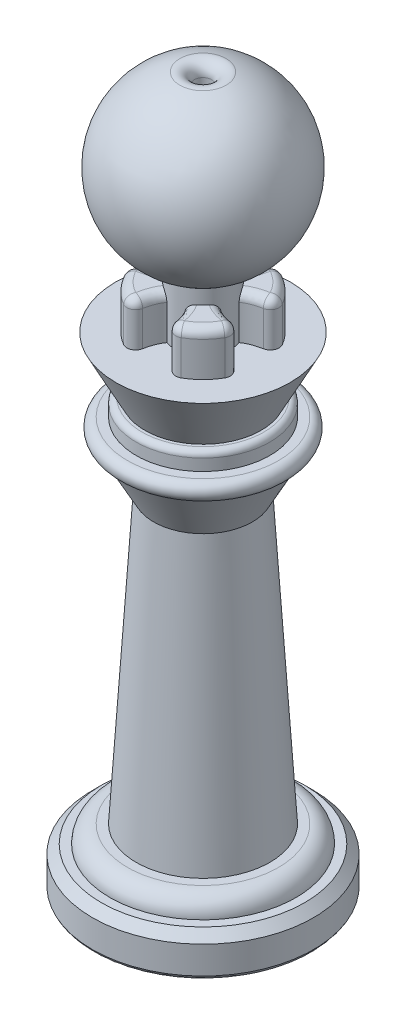
from build123d import *

# Parameters (mm, degrees)
FILLET2_R          = 1.524
CHAMFER1_SIZE      = 0.762
FILLET3_R          = 0.508
SKETCH2_RX         = 3.18469238
SKETCH2_RY         = 1.495075601
CUT_EXTRUDE1_DEPTH = 3.81
FILLET4_R          = 0.762
SKETCH7_R          = 0.75
CUT_EXTRUDE2_DEPTH = 65
SKETCH8_R          = 5.1
CUT_EXTRUDE3_DEPTH = 4
FILLET6_R          = 1


# Some blends are built 0.0001 mm under size
with BuildPart() as part:
    # Sketch1 → Revolve1 (revolve)
    with BuildSketch(Plane.XY, mode=Mode.PRIVATE) as revolve1_sk:
        with BuildLine():
            Line((0, 0), (-9.652, 0))
            Line((-9.652, 0), (-9.652, 3.175))
            Line((-9.652, 3.175), (-8.128, 3.175))
            Line((-8.128, 3.175), (-8.128, 4.699))
            Line((-8.128, 4.699), (-5.842, 4.699))
            Line((-5.842, 4.699), (-4.318, 29.707436315))
            Line((-4.318, 29.707436315), (-6.604, 33.968286919))
            ThreePointArc((-6.604, 33.968286919), (-7.366, 34.730286919), (-6.604, 35.492286919))
            Line((-6.604, 35.492286919), (-5.842, 35.492286919))
            Line((-5.842, 35.492286919), (-5.842, 37.016286919))
            Line((-5.842, 37.016286919), (-5.08, 37.016286919))
            Line((-5.08, 37.016286919), (-7.62, 41.91))
            Line((-7.62, 41.91), (-5.08, 41.91))
            Line((-5.08, 41.91), (-5.08, 45.72))
            Line((-5.08, 45.72), (0, 45.72))
            Line((0, 45.72), (0, 0))
        make_face()
    revolve(revolve1_sk.sketch.rotate(Axis((0, 0, 0), (0, 1, 0)), 270), axis=Axis((0, 0, 0), (0, 1, 0)))

    # Fillet2
    fillet2_edges = [part.edges().sort_by_distance(p)[0] for p in [
        (0, 4.699, 8.128),
    ]]
    fillet(fillet2_edges, radius=FILLET2_R - 0.0001)  # a hair under: the kernel refuses the full size

    # Chamfer1
    chamfer1_edges = [part.edges().sort_by_distance(p)[0] for p in [
        (0, 3.175, 9.652),
    ]]
    chamfer(chamfer1_edges, length=CHAMFER1_SIZE)

    # Fillet3
    fillet3_edges = [part.edges().sort_by_distance(p)[0] for p in [
        (0, 37.016286919, 5.842),
    ]]
    fillet(fillet3_edges, radius=FILLET3_R)

    # Sketch2 → Cut-Extrude1 (cut)
    with BuildSketch(Plane(origin=(0, 45.72, 0), x_dir=(1, 0, 0), z_dir=(0, 1, 0))):
        with Locations(Location((0, 5.08), (0, 0, 90))):
            Ellipse(SKETCH2_RX, SKETCH2_RY)
        with Locations(Location((5.08, 0), (0, 0, 180))):
            Ellipse(SKETCH2_RX, SKETCH2_RY)
        with Locations(Location((0, -5.08), (0, 0, -90))):
            Ellipse(SKETCH2_RX, SKETCH2_RY)
        with Locations(Location((-5.08, 0), (0, 0, 180))):
            Ellipse(SKETCH2_RX, SKETCH2_RY)
    extrude(amount=-CUT_EXTRUDE1_DEPTH, mode=Mode.SUBTRACT)

    # Fillet4
    fillet4_edges = [part.edges().sort_by_distance(p)[0] for p in [
        (3.106064938, 45.72, 1.173251988),
        (3.592102448, 45.72, 3.592102448),
        (-0.000114607, 45.72, 1.89530763),
        (-3.592102448, 45.72, 3.592102448),
        (-1.89530763, 45.72, -0.000114607),
        (-3.592102448, 45.72, -3.592102448),
        (0.000114607, 45.72, -1.89530763),
        (3.592102448, 45.72, -3.592102448),
        (-4.856149959, 43.815, 1.491377746),
        (-4.856149959, 43.815, -1.491377746),
        (1.491377746, 43.815, 4.856149959),
        (-1.491377746, 43.815, 4.856149959),
        (4.856149959, 43.815, 1.491377746),
        (4.856149959, 43.815, -1.491377746),
        (-1.491377746, 43.815, -4.856149959),
        (1.491377746, 43.815, -4.856149959),
    ]]
    fillet(fillet4_edges, radius=FILLET4_R)

    # Sketch6 → Revolve2 (revolve)
    with BuildSketch(Plane(origin=(0, 0, 0), x_dir=(0.9992033326108174, 0, 0.03990864692565036), z_dir=(-0.03990864692565036, 0, 0.9992033326108174)), mode=Mode.PRIVATE) as revolve2_sk:
        with BuildLine():
            ThreePointArc((0, 61.891067812), (-7.391989197, 55.659332652), (-2.5, 47.32))
            Line((-2.5, 47.32), (0, 47.32))
            Line((0, 47.32), (0, 61.891067812))
        make_face()
        with BuildLine():
            Line((0, 47.32), (-2.5, 47.32))
            ThreePointArc((-2.5, 47.32), (-1.26826484, 46.999078614), (0, 46.891067812))
            Line((0, 46.891067812), (0, 47.32))
        make_face()
        with BuildLine():
            ThreePointArc((0, 46.891067812), (-1.26826484, 46.999078614), (-2.5, 47.32))
            Line((-2.5, 47.32), (-2.5, 41.91))
            Line((-2.5, 41.91), (0, 41.91))
            Line((0, 41.91), (0, 46.891067812))
        make_face()
        Polygon((-5.37, -2.68), (0, -2.68), (0, 0), (-10, 0), align=None)
    revolve(revolve2_sk.sketch.rotate(Axis((0, 47.32, 0), (0, 1, 0)), 272.287204448), axis=Axis((0, 47.32, 0), (0, 1, 0)))

    # Sketch7 → Cut-Extrude2 (cut)
    with BuildSketch(Plane.XZ.offset(2.68)):
        with Locations(Location((0, 0, 0), (0, 0, 270))):
            Circle(SKETCH7_R)
    extrude(amount=-CUT_EXTRUDE2_DEPTH, mode=Mode.SUBTRACT)

    # Sketch8 → Cut-Extrude3 (cut)
    with BuildSketch(Plane.XZ.offset(2.68)):
        with Locations(Location((0, 0, 0), (0, 0, 270))):
            Circle(SKETCH8_R)
    extrude(amount=-CUT_EXTRUDE3_DEPTH, mode=Mode.SUBTRACT)

    # Fillet6
    # the kernel refuses this fillet: 1 mm, written as the material it takes off along each edge
    with BuildSketch(Plane(origin=(0, 0, 0), x_dir=(-7.314496230925727e-12, 0, -1.0), z_dir=(1.0, 0, -7.314496230925727e-12))) as fillet6_piece_1:
        with BuildLine():
            CenterArc((8.75010917, 0.431964039), FILLET6_R, 300.063704509, 34.344027753)
            Line((9.652, 0), (10, 0))
            Line((10, 0), (9.251071754, -0.433504902))
        make_face()
    revolve(axis=Axis((0, 0, 0), (0, 1, 0)), mode=Mode.SUBTRACT)
    with BuildSketch(Plane(origin=(0, 61.85347359, 0), x_dir=(0, 0, -1), z_dir=(-1, 0, 0))) as fillet6_piece_2:
        with BuildLine():
            CenterArc((1.75, 1.202413766), FILLET6_R, 180, 105.618498276)
            Line((0.75, 1.202413766), (0.75, 0))
            ThreePointArc((0.75, 0), (1.389777119, 0.092295904), (2.019230769, 0.239338071))
        make_face()
    revolve(axis=Axis((0, 61.85347359, 0), (0, -1, 0)), mode=Mode.SUBTRACT)
    with BuildSketch(Plane(origin=(0, -2.68, 0), x_dir=(0, 0, -1), z_dir=(-1, 0, 0))) as fillet6_piece_3:
        with BuildLine():
            CenterArc((6.1, -0.683447145), FILLET6_R, 136.886394054, 43.113605946)
            Line((5.37, 0), (5.1, 0))
            Line((5.1, 0), (5.1, -0.683447145))
        make_face()
    revolve(axis=Axis((0, -2.68, 0), (0, -1, 0)), mode=Mode.SUBTRACT)


solid = part.part
